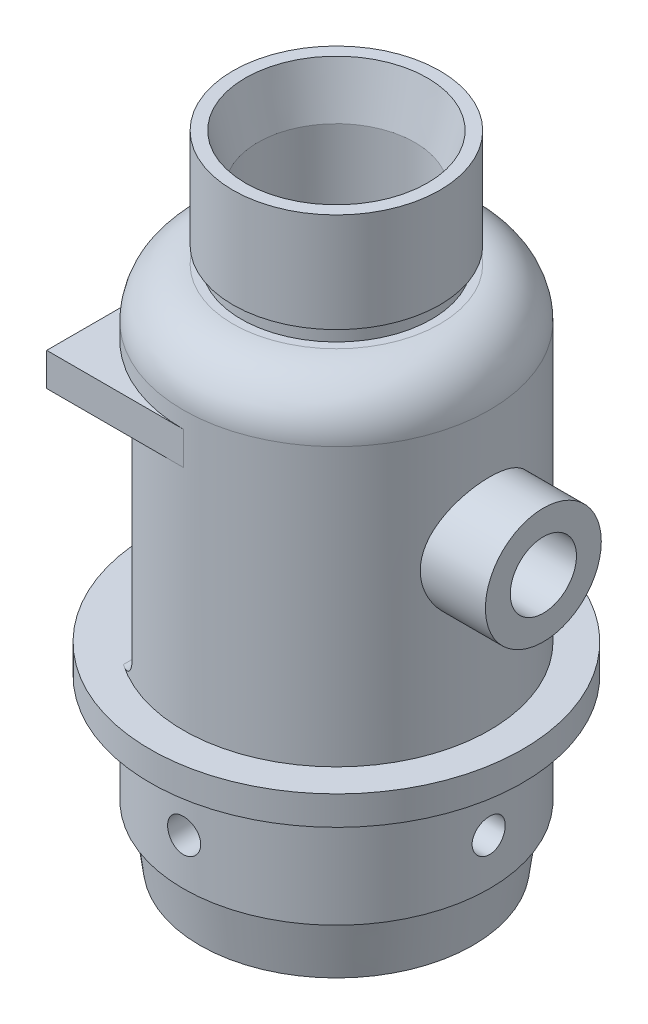
from build123d import *
from build123d.topology import SkipClean

# Parameters (mm, degrees)
SKETCH2_W                = 2
SKETCH2_H                = 4
SKETCH2_W_2              = 5
SKETCH2_H_2              = 4.143593539
BOSS_EXTRUDE2_REACH      = 188.456
BOSS_EXTRUDE2_END_RADIUS = 37
SKETCH4_R                = 14
HOLE1_REACH              = 188.456
HOLE1_BORE_R             = 8
FILLET1_R                = 12
HOLE2_D                  = 56
HOLE2_DEPTH              = 119
SKETCH11_R               = 4
CUT_EXTRUDE1_DEPTH       = 169.050587651
CIRPATTERN1_COUNT        = 4
BOSS_EXTRUDE3_DEPTH      = 8
CUT_EXTRUDE2_DEPTH       = 123.184287167
CUT_EXTRUDE2_DEPTH_BACK  = 55
SKETCH14_W               = 21
SKETCH14_H               = 55
CUT_EXTRUDE3_DEPTH       = 40
CHAMFER1_SIZE            = 12
CHAMFER1_SIZE2           = 3
FILLET2_R                = 5
FILLET3_R                = 5


with BuildPart() as part:
    # Sketch1 → Revolve1 (revolve)
    with BuildSketch(Plane.XY, mode=Mode.PRIVATE) as revolve1_sk:
        Polygon((-19, 0), (-19, 154), (-25, 154), (-25, 126), (-37, 126), (-37, 47), (-45, 47), (-45, 40), (-37, 40), (-37, 13.856406461), (-35, 13.856406461), (-33, 0), align=None)
    revolve(revolve1_sk.sketch.rotate(Axis((0, 0, 0), (0, 1, 0)), 270), axis=Axis((0, 0, 0), (0, 1, 0)))

    # Sketch2 → Cut-Revolve1 (revolve, cut)
    with BuildSketch(Plane.XY, mode=Mode.PRIVATE) as cut_revolve1_sk:
        with Locations((24, 128)):
            Rectangle(SKETCH2_W, SKETCH2_H)
        with Locations((34.5, 37.928203231)):
            Rectangle(SKETCH2_W_2, SKETCH2_H_2)
    revolve(cut_revolve1_sk.sketch.rotate(Axis((0, 0, 0), (0, 1, 0)), 90), axis=Axis((0, 0, 0), (0, 1, 0)), mode=Mode.SUBTRACT)

    # Boss-Extrude2: up to this cylinder (the profile starts outside it)
    boss_extrude2_end = Plane(origin=(0, 86, 0), z_dir=(0, -1, 0)) * Cylinder(BOSS_EXTRUDE2_END_RADIUS, 451.912, mode=Mode.PRIVATE)
    # Sketch4 → Boss-Extrude2 (add, up to the surface)
    with BuildSketch(Plane(origin=(50, 0, 0), x_dir=(0, 0, -1), z_dir=(1, 0, 0)), mode=Mode.PRIVATE) as boss_extrude2_sk1:
        with Locations((0, 86)):
            Circle(SKETCH4_R)
    boss_extrude2_tool1 = extrude(boss_extrude2_sk1.sketch, amount=-BOSS_EXTRUDE2_REACH, mode=Mode.PRIVATE) - boss_extrude2_end
    add(boss_extrude2_tool1.solids().sort_by_distance((50, 86, 0))[0])

    # Hole1 bore → Hole1 (cut, up to next)
    with BuildSketch(Plane(origin=(50, 0, 0), x_dir=(0, 0, -1), z_dir=(1, 0, 0)), mode=Mode.PRIVATE) as hole1_sk1:
        with Locations((0, 86)):
            Circle(HOLE1_BORE_R)
    hole1_tool1 = extrude(hole1_sk1.sketch, amount=-HOLE1_REACH, mode=Mode.PRIVATE) & part.part
    add(hole1_tool1.solids().sort_by_distance((50, 86, 0))[0], mode=Mode.SUBTRACT)

    # Fillet1
    fillet1_edges = [part.edges().sort_by_distance(p)[0] for p in [
        (0, 126, 37),
    ]]
    fillet(fillet1_edges, radius=FILLET1_R)

    # Hole2
    with Locations(Plane(origin=(0, 0, 0), x_dir=(-1, 0, 0), z_dir=(0, -1, 0))):
        with Locations((0, 0)):
            Hole(HOLE2_D / 2, depth=HOLE2_DEPTH)

    # Sketch11 → Cut-Extrude1 (cut, through all)
    with BuildSketch(Plane.XY):
        with Locations(Location((0, 25, 0), (0, 0, 90))):
            Circle(SKETCH11_R)
    cut_extrude1 = extrude(amount=-CUT_EXTRUDE1_DEPTH, mode=Mode.SUBTRACT)

    # CirPattern1: Cut-Extrude1 ×4 about axis
    cirpattern1_axis = Axis((0, 0, 0), (0, -1, 0))
    for i in range(1, CIRPATTERN1_COUNT):
        add(cut_extrude1.rotate(cirpattern1_axis, i * 360 / CIRPATTERN1_COUNT), mode=Mode.SUBTRACT)

    # Sketch12 → Boss-Extrude3 (add)
    with BuildSketch(Plane(origin=(0, 102, 0), x_dir=(1, 0, 0), z_dir=(0, 1, 0))):
        with BuildLine():
            Line((-33, 37), (-33, 16.733200531))
            ThreePointArc((-33, 16.733200531), (-19.36325877, 31.52878383), (0, 37))
            Line((0, 37), (-33, 37))
        make_face()
        with BuildLine():
            Line((0, -37), (-33, -37))
            Line((-33, -37), (-33, -16.733200531))
            ThreePointArc((-33, -16.733200531), (-19.36325877, -31.52878383), (0, -37))
        make_face()
    extrude(amount=BOSS_EXTRUDE3_DEPTH)

    # Sketch13 → Cut-Extrude2 (cut, two sides: drawn at the far end of the back side and taken through both)
    with SkipClean():  # the faces are left unmerged after this step: merging them gives an invalid solid
        with BuildSketch(Plane(origin=(0, 102, 0), x_dir=(1, 0, 0), z_dir=(0, 1, 0)).offset(-CUT_EXTRUDE2_DEPTH_BACK)):
            with BuildLine():
                Line((-33, 16.733200531), (-33, -16.733200531))
                ThreePointArc((-33, -16.733200531), (-37, 0), (-33, 16.733200531))
            make_face()
        extrude(amount=CUT_EXTRUDE2_DEPTH + CUT_EXTRUDE2_DEPTH_BACK, mode=Mode.SUBTRACT)
    add(part.part.scale(1), mode=Mode.REPLACE)  # the faces are merged on a copy

    # Sketch14 → Cut-Extrude3 (cut, symmetric)
    with BuildSketch(Plane.XY):
        with Locations((-26.5, 74.5)):
            Rectangle(SKETCH14_W, SKETCH14_H)
    extrude(amount=CUT_EXTRUDE3_DEPTH, both=True, mode=Mode.SUBTRACT)

    # Chamfer1
    chamfer1_edges = [part.edges().sort_by_distance(p)[0] for p in [
        (0, 154, 19),
    ]]
    chamfer1_side = [part.faces().sort_by_distance(p)[0] for p in [
        (0, 136.5, 19),
    ]]
    chamfer(chamfer1_edges, length=CHAMFER1_SIZE, length2=CHAMFER1_SIZE2, reference=chamfer1_side[0])

    # Fillet2
    fillet2_edges = [part.edges().sort_by_distance(p)[0] for p in [
        (-16, 47, -28.169952611),
        (-16, 47, 28.169952611),
        (-16, 102, 28.169952611),
        (-16, 102, -28.169952611),
    ]]
    fillet(fillet2_edges, radius=FILLET2_R)

    # Fillet3
    fillet3_edges = [part.edges().sort_by_distance(p)[0] for p in [
        (0, 119, 19),
    ]]
    fillet(fillet3_edges, radius=FILLET3_R)


solid = part.part
